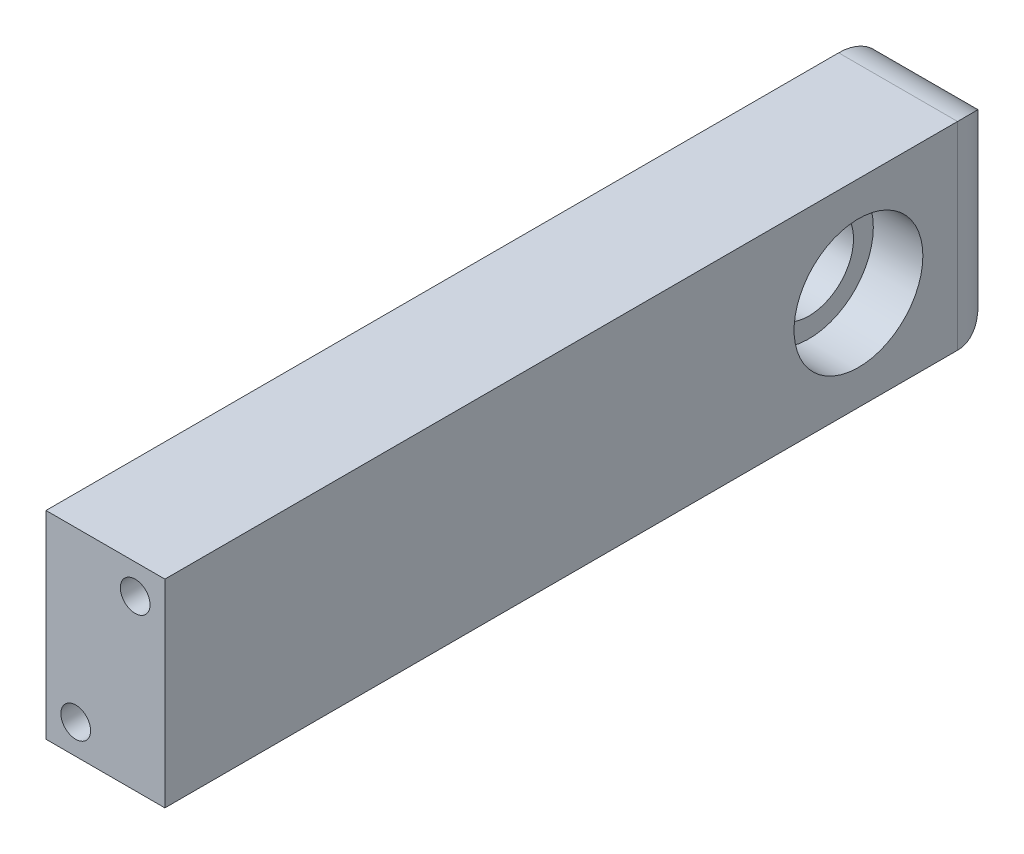
from build123d import *

# Parameters (mm, degrees)
SZKIC1_W                    = 12
SZKIC1_H                    = 20
DODANIE_WYCI_GNI_CIE1_DEPTH = 85
SZKIC2_R                    = 1.5
WYTNIJ_WYCI_GNI_CIE1_DEPTH  = 10
SZKIC5_R                    = 6.5
WYTNIJ_WYCI_GNI_CIE4_DEPTH  = 5
SZKIC6_R                    = 4.5
WYTNIJ_WYCI_GNI_CIE5_DEPTH  = 87.423376467
ZAOKR_GLENIE1_R             = 5


with BuildPart() as part:
    # Szkic1 → Dodanie-wyciągnięcie1 (new body)
    with BuildSketch(Plane.XY):
        Rectangle(SZKIC1_W, SZKIC1_H)
    extrude(amount=DODANIE_WYCI_GNI_CIE1_DEPTH)

    # Szkic2 → Wytnij-wyciągnięcie1 (cut)
    with BuildSketch(Plane.XY.offset(85)):
        with Locations((3, 7)):
            Circle(SZKIC2_R)
        with Locations((-3, -7)):
            Circle(SZKIC2_R)
    extrude(amount=-WYTNIJ_WYCI_GNI_CIE1_DEPTH, mode=Mode.SUBTRACT)

    # Szkic5 → Wytnij-wyciągnięcie4 (cut)
    with BuildSketch(Plane(origin=(6, 0, 0), x_dir=(0, 0, -1), z_dir=(1, 0, 0))):
        with Locations((-15, 0)):
            Circle(SZKIC5_R)
    extrude(amount=-WYTNIJ_WYCI_GNI_CIE4_DEPTH, mode=Mode.SUBTRACT)

    # Szkic6 → Wytnij-wyciągnięcie5 (cut, through all)
    with BuildSketch(Plane.ZY.offset(6)):
        with Locations((15, 0)):
            Circle(SZKIC6_R)
    extrude(amount=-WYTNIJ_WYCI_GNI_CIE5_DEPTH, mode=Mode.SUBTRACT)

    # Zaokrąglenie1
    zaokr_glenie1_edges = [part.edges().sort_by_distance(p)[0] for p in [
        (0, -10, 0),
        (6, 0, 0),
        (0, 10, 0),
    ]]
    fillet(zaokr_glenie1_edges, radius=ZAOKR_GLENIE1_R)


solid = part.part
